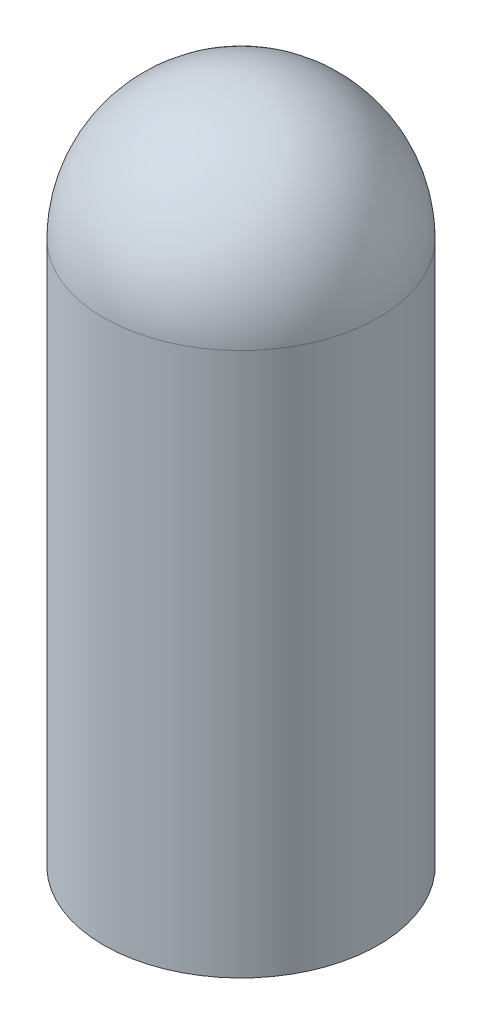
from build123d import *

# Parameters (mm, degrees)
SKETCH1_R           = 51.3588
BOSS_EXTRUDE1_DEPTH = 203.2
DOME1_FACE_RADIUS   = 51.3588
DOME1_HEIGHT        = 50.8


# Read off the part's stored shape, not the designer's step: Shell1
with BuildPart() as part:
    # Sketch1 → Boss-Extrude1 (new body)
    with BuildSketch(Plane(origin=(0, 0, 0), x_dir=(1, 0, 0), z_dir=(0, 1, 0))):
        with Locations(Location((0, 0, 0), (0, 0, 270))):
            Circle(SKETCH1_R)
    extrude(amount=BOSS_EXTRUDE1_DEPTH)

    # Dome1: a dome of height H over a round flat face of radius A is a cap of a sphere of radius (A * A + H * H) / (2 * H)
    dome1_r = (DOME1_FACE_RADIUS * DOME1_FACE_RADIUS + DOME1_HEIGHT * DOME1_HEIGHT) / (2 * DOME1_HEIGHT)
    dome1_base = Plane((0, 203.2, 0), z_dir=(0, 1, 0))
    with Locations(dome1_base.offset(DOME1_HEIGHT - dome1_r)):
        dome1_ball = Sphere(dome1_r, mode=Mode.PRIVATE)
    add(split(dome1_ball, bisect_by=dome1_base, keep=Keep.TOP, mode=Mode.PRIVATE))

    # Shell1 outline → Shell1 (revolve, cut)
    with BuildSketch(Plane.XY):
        with BuildLine():
            Line((50.8, 0), (50.800000001, 203.196935001))
            ThreePointArc((50.800000001, 203.196935001), (35.725082804, 238.75835259), (0, 253.4412))
            Line((0, 253.4412), (0, 0))
            Line((0, 0), (50.8, 0))
        make_face()
    revolve(axis=Axis((0, 0, 0), (0, 1, 0)), mode=Mode.SUBTRACT)


solid = part.part
